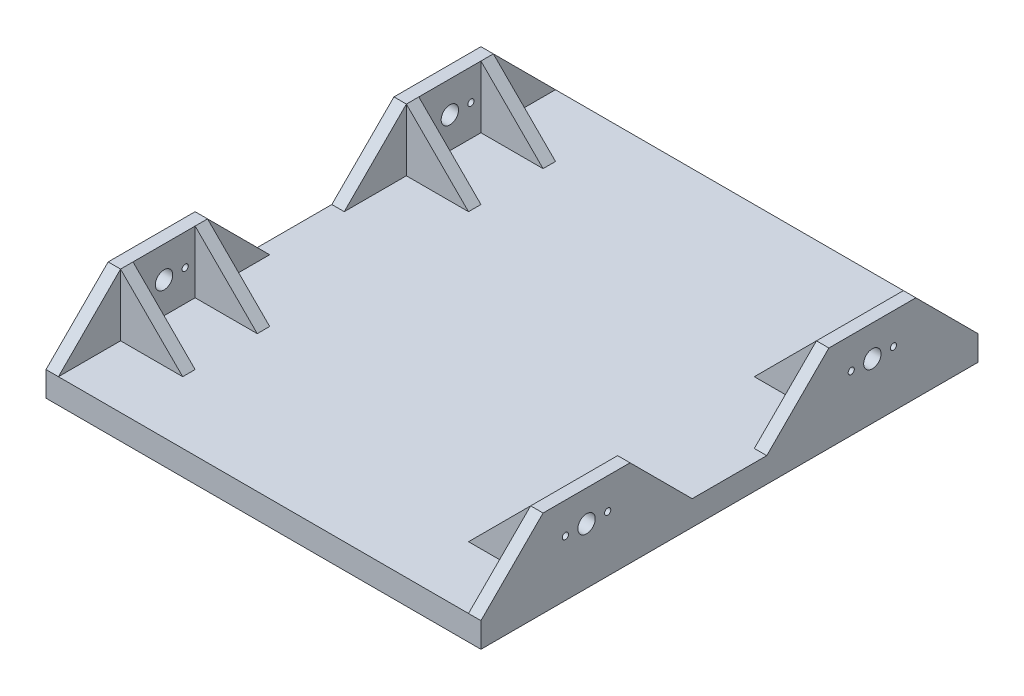
from build123d import *

# Parameters (mm, degrees)
SKETCH1_W                = 175
SKETCH1_H                = 200
BOSS_EXTRUDE1_DEPTH      = 10
SKETCH3_W                = 5
SKETCH3_H                = 25
SKETCH3_W_2              = 25
SKETCH3_H_2              = 5
BOSS_EXTRUDE2_DEPTH      = 25
CHAMFER1_SIZE            = 25
SKETCH4_R                = 3.5
SKETCH4_R_2              = 1.25
CUT_EXTRUDE1_DEPTH       = 25
CHAMFER1_OF_MIRROR1_SIZE = 25


# Read off the part's stored shape, not the designer's step: Mirror2
with BuildPart() as part:
    # Sketch1 → Boss-Extrude1 (new body)
    with BuildSketch(Plane(origin=(0, 0, 0), x_dir=(1, 0, 0), z_dir=(0, 1, 0))):
        with Locations((87.5, 100)):
            Rectangle(SKETCH1_W, SKETCH1_H)
    extrude(amount=BOSS_EXTRUDE1_DEPTH)

    # Sketch3 → Boss-Extrude2 (add)
    with BuildSketch(Plane(origin=(0, 10, 0), x_dir=(1, 0, 0), z_dir=(0, 1, 0))):
        with Locations((2.5, 72.5)):
            Rectangle(SKETCH3_W, SKETCH3_H)
        Polygon((0, 60), (0, 25), (5, 25), (5, 30), (5, 55), (5, 60), align=None)
        with Locations((17.5, 57.5)):
            Rectangle(SKETCH3_W_2, SKETCH3_H_2)
        with Locations((17.5, 27.5)):
            Rectangle(SKETCH3_W_2, SKETCH3_H_2)
        with Locations((2.5, 12.5)):
            Rectangle(SKETCH3_W, SKETCH3_H)
    boss_extrude2 = extrude(amount=BOSS_EXTRUDE2_DEPTH)

    # Chamfer1
    chamfer1_edges = [part.edges().sort_by_distance(p)[0] for p in [
        (2.5, 35, -85),
        (30, 35, -57.5),
        (30, 35, -27.5),
        (2.5, 35, 0),
    ]]
    chamfer(chamfer1_edges, length=CHAMFER1_SIZE - 0.0001)  # a hair under: the kernel refuses the full size

    # Sketch4 → Cut-Extrude1 (cut)
    with BuildSketch(Plane(origin=(5, 0, 0), x_dir=(0, 0, -1), z_dir=(1, 0, 0))):
        with Locations((42.5, 22.5)):
            Circle(SKETCH4_R)
        with Locations((34, 22.5)):
            Circle(SKETCH4_R_2)
        with Locations((51, 22.5)):
            Circle(SKETCH4_R_2)
    cut_extrude1 = extrude(amount=-CUT_EXTRUDE1_DEPTH, mode=Mode.SUBTRACT)

    # Mirror1: Boss-Extrude2, Cut-Extrude1 across plane
    add(boss_extrude2.mirror(Plane(origin=(87.5, 0, 0), x_dir=(0, 0, 1), z_dir=(1, 0, 0))))
    add(cut_extrude1.mirror(Plane(origin=(87.5, 0, 0), x_dir=(0, 0, 1), z_dir=(1, 0, 0))), mode=Mode.SUBTRACT)

    # Chamfer1 of Mirror1
    chamfer1_of_mirror1_edges = [part.edges().sort_by_distance(p)[0] for p in [
        (172.5, 35, -85),
        (145, 35, -57.5),
        (145, 35, -27.5),
        (172.5, 35, 0),
    ]]
    chamfer(chamfer1_of_mirror1_edges, length=CHAMFER1_OF_MIRROR1_SIZE - 0.0001)  # a hair under: the kernel refuses the full size

    # Mirror2: part across plane


with BuildPart() as part_1:
    add(part.part)
    add(part.part.mirror(Plane.XY.offset(-100)))


solid = part_1.part
